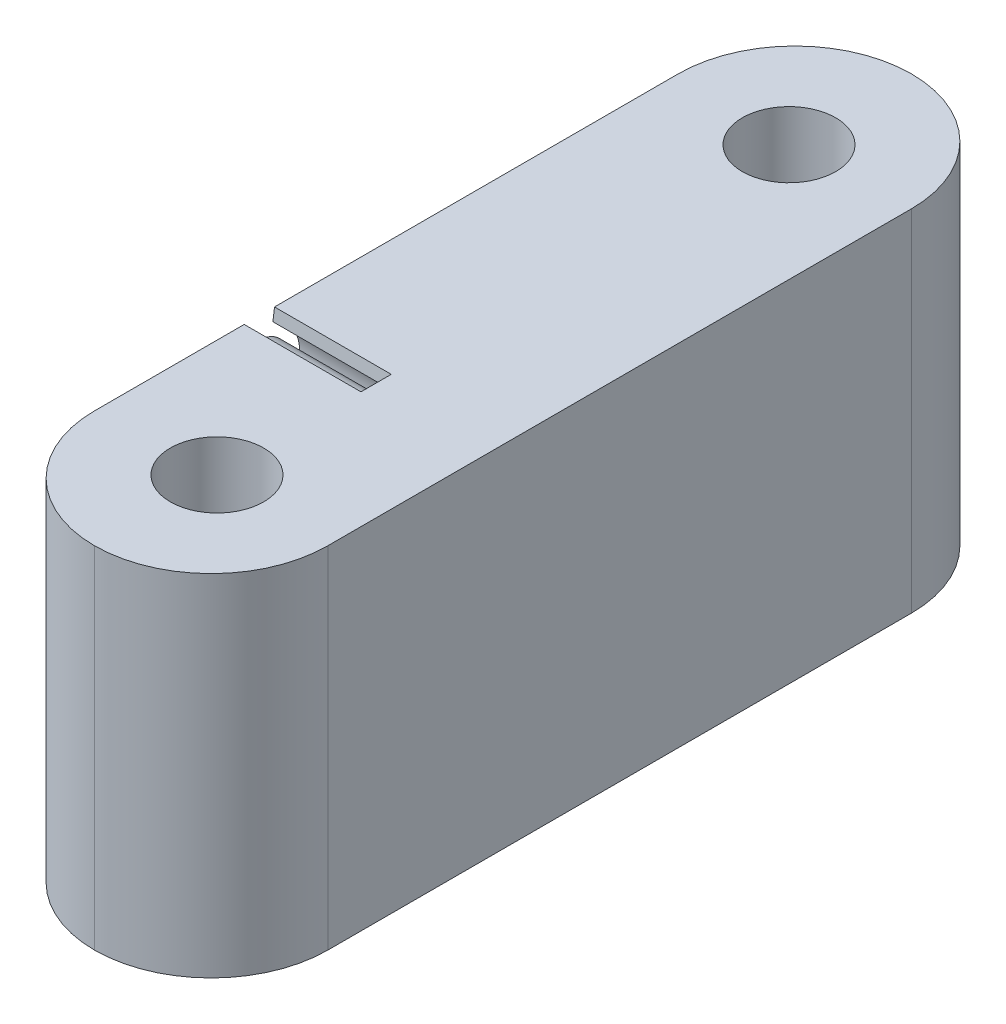
from build123d import *

# Parameters (mm, degrees)
SKETCH2_W           = 20
SKETCH2_H           = 70
BOSS_EXTRUDE1_DEPTH = 30
SKETCH3_R           = 4
CUT_EXTRUDE1_DEPTH  = 20
SKETCH4_R           = 2.5
CUT_EXTRUDE2_DEPTH  = 10
FILLET1_R           = 10


with BuildPart() as part:
    # Sketch2 → Boss-Extrude1 (new body)
    with BuildSketch(Plane(origin=(0, 0, 0), x_dir=(1, 0, 0), z_dir=(0, 1, 0))):
        with Locations((6.47761194, -5.23880597)):
            Rectangle(SKETCH2_W, SKETCH2_H)
    extrude(amount=BOSS_EXTRUDE1_DEPTH)

    # Sketch3 → Cut-Extrude1 (cut)
    with BuildSketch(Plane(origin=(0, 30, 0), x_dir=(1, 0, 0), z_dir=(0, 1, 0))):
        with Locations(Location((6.47761194, 19.26119403, 0), (0, 0, 270))):
            Circle(SKETCH3_R)
        with Locations(Location((6.47761194, -29.73880597, 0), (0, 0, 270))):
            Circle(SKETCH3_R)
    extrude(amount=-CUT_EXTRUDE1_DEPTH, mode=Mode.SUBTRACT)

    # Sketch4 → Cut-Extrude2 (cut)
    with BuildSketch(Plane.ZY.offset(3.52238806)):
        with BuildLine():
            Line((17.415034126, 30.126407987), (14.795699792, 30.126407987))
            Line((14.795699792, 30.126407987), (14.949961333, 28.969446425))
            ThreePointArc((14.949961333, 28.969446425), (16.17927412, 22.186618473), (17.347611009, 28.980215007))
            Line((17.347611009, 28.980215007), (17.415034126, 30.126407987))
        make_face()
        with Locations((16.163554702, 25.686583173)):
            Circle(SKETCH4_R, mode=Mode.SUBTRACT)
    extrude(amount=-CUT_EXTRUDE2_DEPTH, mode=Mode.SUBTRACT)

    # Fillet1
    fillet1_edges = [part.edges().sort_by_distance(p)[0] for p in [
        (-3.52238806, 15, -29.76119403),
        (16.47761194, 15, -29.76119403),
        (16.47761194, 15, 40.23880597),
        (-3.52238806, 15, 40.23880597),
    ]]
    fillet(fillet1_edges, radius=FILLET1_R - 0.0001)  # a hair under: the kernel refuses the full size


solid = part.part
